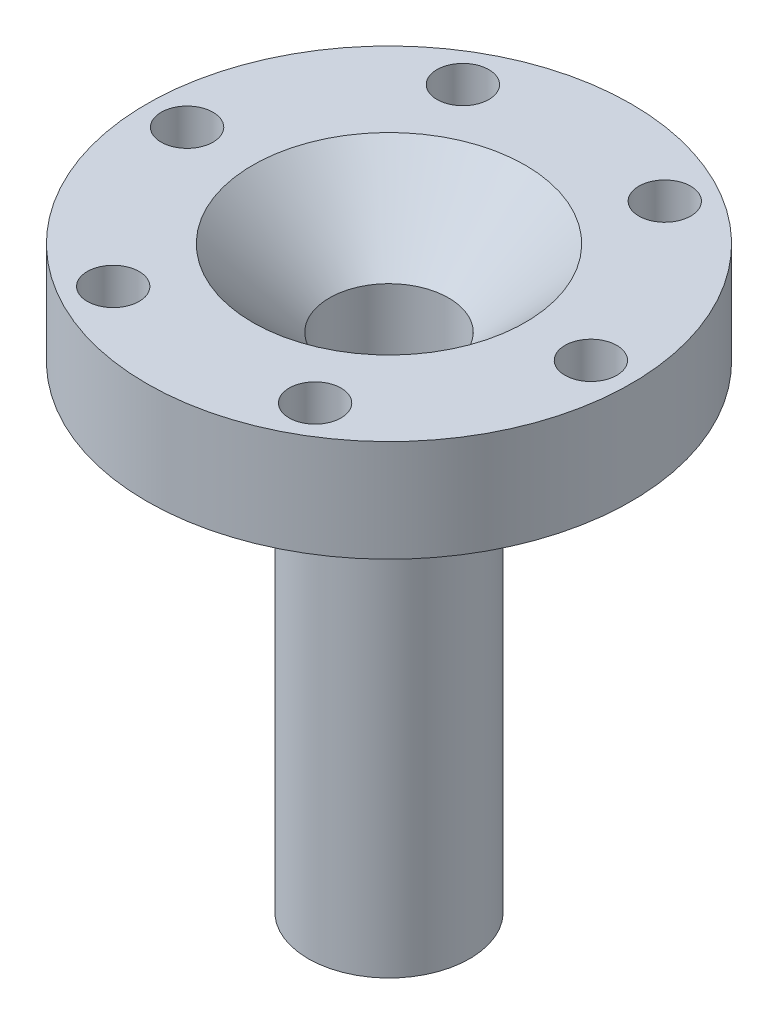
from build123d import *

# Parameters (mm, degrees)
F_1_4_CLEARANCE_HOLE1_D = 6.5278
CIRPATTERN1_COUNT       = 6


with BuildPart() as part:
    # Sketch1 → Revolve1 (revolve)
    with BuildSketch(Plane.XY):
        Polygon((7.5, -72.82), (7.5, -9.645), (17.145, 0), (30.48, 0), (30.48, -12.82), (10.16, -12.82), (10.16, -72.82), align=None)
    revolve(axis=Axis((0, 0, 0), (0, -1, 0)))

    # 1/4 Clearance Hole1 (through all)
    with Locations(Plane(origin=(0, 0, 0), x_dir=(1, 0, 0), z_dir=(0, 1, 0))):
        with Locations((25.4, 0)):
            f_1_4_clearance_hole1 = Hole(F_1_4_CLEARANCE_HOLE1_D / 2)

    # CirPattern1: 1/4 Clearance Hole1 ×6 about axis
    cirpattern1_axis = Axis((0, 0, 0), (0, 1, 0))
    for i in range(1, CIRPATTERN1_COUNT):
        add(f_1_4_clearance_hole1.rotate(cirpattern1_axis, i * 360 / CIRPATTERN1_COUNT), mode=Mode.SUBTRACT)


solid = part.part
